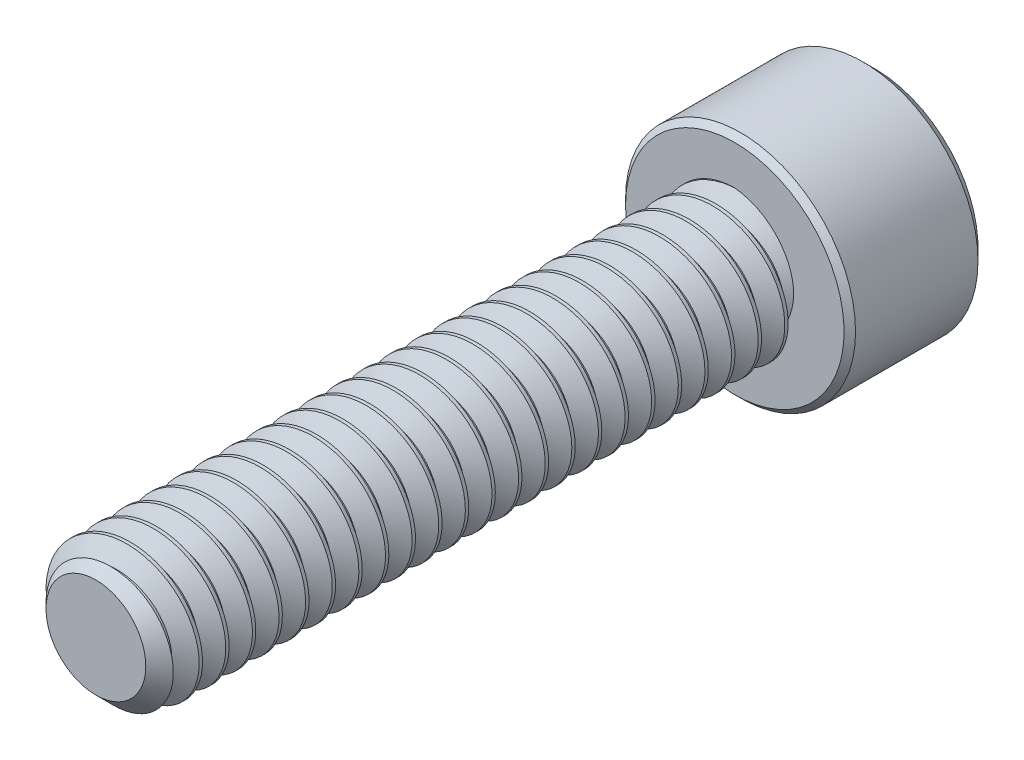
from build123d import *

# Parameters (mm, degrees)
SKETCH1_R          = 2.0828
EXTRUDE1_DEPTH     = 19.05
CHAMFER3_SIZE      = 0.5953125
CUT_SWEEP1_PITCH   = 0.79375
SKETCH6_R          = 3.429
EXTRUDE2_DEPTH     = 4.1656
CUT_EXTRUDE1_DEPTH = 2.67890625
CHAMFER1_SIZE      = 0.3429
CHAMFER2_SIZE      = 0.17145


with BuildPart() as part:
    # Sketch1 → Extrude1 (new body)
    with BuildSketch(Plane.XY):
        Circle(SKETCH1_R)
    extrude(amount=-EXTRUDE1_DEPTH)

    # Chamfer3
    chamfer3_edges = [part.edges().sort_by_distance(p)[0] for p in [
        (-2.0828, 0, 0),
    ]]
    chamfer(chamfer3_edges, length=CHAMFER3_SIZE)

    # Cut-Sweep1: the profile of Sketch3 profile screwed along a right-hand helix of 25 turns, 6 arcs to a turn; built about Z, then put on its axis
    cut_sweep1_z = Axis((0, 0, 0), (0, 0, 1))
    cut_sweep1_corners = [(2.0831, 0, -0.694704455), (1.567244252, 0, -0.396875), (1.567244252, 0, -0.29765625), (2.0831, 0, 0.000173205)]
    with BuildLine(mode=Mode.PRIVATE) as cut_sweep1_profile:
        Line(cut_sweep1_corners[0], cut_sweep1_corners[1])
        Line(cut_sweep1_corners[1], cut_sweep1_corners[2])
        Line(cut_sweep1_corners[2], cut_sweep1_corners[3])
        Line(cut_sweep1_corners[3], cut_sweep1_corners[0])
    cut_sweep1_cap = Face(cut_sweep1_profile.wire())
    cut_sweep1_turn_angles = [0, 30, 60, 90, 120, 150, 180, 210, 240, 270, 300, 330, 360]
    cut_sweep1_turn_weights = [1, 0.8660254037844387, 1, 0.8660254037844387, 1, 0.8660254037844387, 1, 0.8660254037844387, 1, 0.8660254037844387, 1, 0.8660254037844387, 1]
    cut_sweep1_turn_rails = [Edge.make_bspline([Vector(p[0], p[1], 0).rotate(cut_sweep1_z, cut_sweep1_turn_angles[k]) / cut_sweep1_turn_weights[k] + Vector(0, 0, p[2] + CUT_SWEEP1_PITCH * cut_sweep1_turn_angles[k] / 360) for k in range(13)], [0, 0, 0, 1, 1, 2, 2, 3, 3, 4, 4, 5, 5, 6, 6, 6], 2, cut_sweep1_turn_weights) for p in cut_sweep1_corners]
    cut_sweep1_turn_sides = [Face.make_surface_from_curves(cut_sweep1_turn_rails[p[0]], cut_sweep1_turn_rails[p[1]]) for p in [(0, 1), (1, 2), (2, 3), (3, 0)]]
    cut_sweep1 = Plane(origin=(0, 0, 0), x_dir=(0, 1, 0), z_dir=(0, 0, -1)) * Solid(Shell([*[p.moved(Location((0, 0, CUT_SWEEP1_PITCH * i))) for i in range(25) for p in cut_sweep1_turn_sides], cut_sweep1_cap, cut_sweep1_cap.rotate(cut_sweep1_z, 9000).moved(Location((0, 0, CUT_SWEEP1_PITCH * 9000 / 360)))]))
    add(cut_sweep1, mode=Mode.SUBTRACT)

    # Sketch6 → Extrude2 (add)
    with BuildSketch(Plane(origin=(0, 0, -19.05), x_dir=(-1, 0, 0), z_dir=(0, 0, -1))):
        Circle(SKETCH6_R)
    extrude(amount=EXTRUDE2_DEPTH)

    # Sketch7 → Cut-Extrude1 (cut)
    with BuildSketch(Plane(origin=(0, 0, -23.2156), x_dir=(-1, 0, 0), z_dir=(0, 0, -1))):
        Polygon((0, 2.062222993), (-1.7859375, 1.031111496), (-1.7859375, -1.031111496), (0, -2.062222993), (1.7859375, -1.031111496), (1.7859375, 1.031111496), align=None)
    extrude(amount=-CUT_EXTRUDE1_DEPTH, mode=Mode.SUBTRACT)

    # Cut-Extrude2 cone 1 section (through the dimple's axis) → Cut-Extrude2 (revolve, cut)
    with BuildSketch(Plane(origin=(0, 0, -23.2156), x_dir=(0, 1, 0), z_dir=(1, 0, 0))):
        Polygon((0, 0), (2.062222993, 0), (0, 2.062222993), align=None)
    revolve(axis=Axis((0, 0, -23.2156), (0, 0, 1)), mode=Mode.SUBTRACT)

    # Chamfer1
    chamfer1_edges = [part.edges().sort_by_distance(p)[0] for p in [
        (3.429, 0, -23.2156),
    ]]
    chamfer(chamfer1_edges, length=CHAMFER1_SIZE)

    # Chamfer2
    chamfer2_edges = [part.edges().sort_by_distance(p)[0] for p in [
        (3.429, 0, -19.05),
    ]]
    chamfer(chamfer2_edges, length=CHAMFER2_SIZE)


solid = part.part
